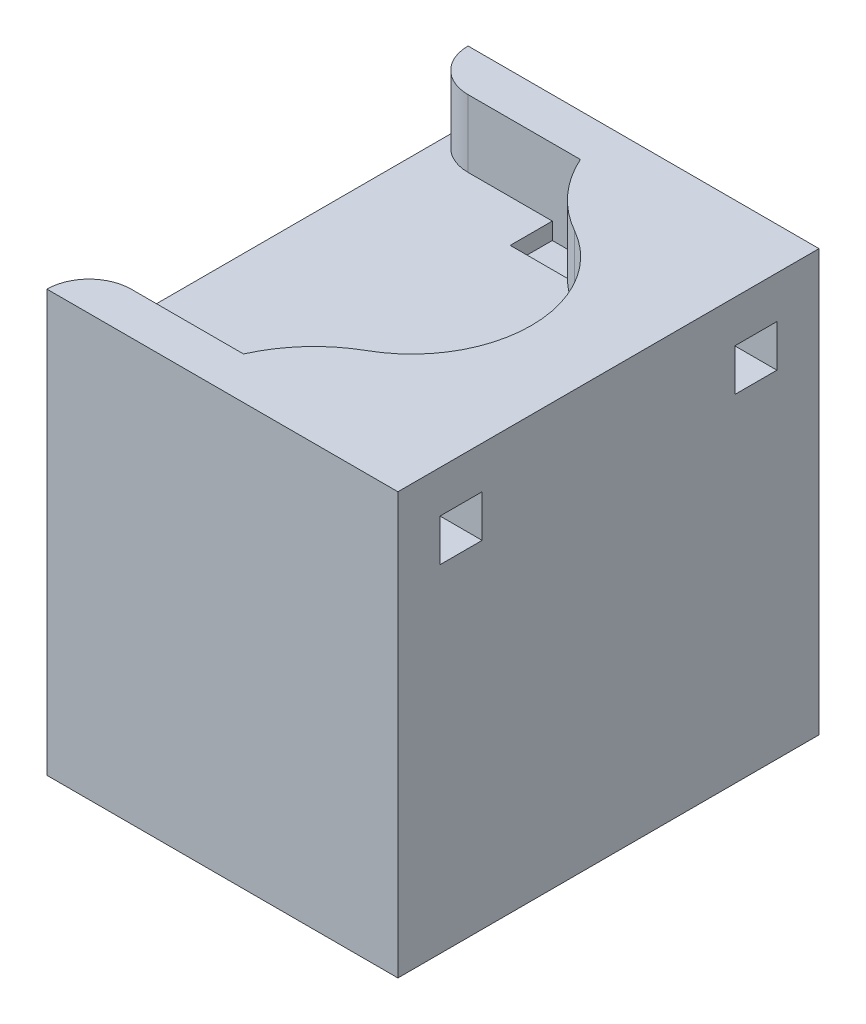
from build123d import *

# Parameters (mm, degrees)
SKETCH1_W           = 25
SKETCH1_H           = 30
BOSS_EXTRUDE1_DEPTH = 30
SKETCH3_W           = 3
SKETCH3_H           = 3
CUT_EXTRUDE1_DEPTH  = 16
CUT_EXTRUDE2_DEPTH  = 4.8
FILLET1_R           = 10
FILLET2_R           = 3


# Some blends are built 0.0001 mm under size
with BuildPart() as part:
    # Sketch1 → Boss-Extrude1 (new body)
    with BuildSketch(Plane(origin=(0, 0, 0), x_dir=(1, 0, 0), z_dir=(0, 1, 0))):
        Rectangle(SKETCH1_W, SKETCH1_H)
    extrude(amount=BOSS_EXTRUDE1_DEPTH)

    # Sketch3 → Cut-Extrude1 (cut)
    with BuildSketch(Plane(origin=(12.5, 0, 0), x_dir=(0, 0, -1), z_dir=(1, 0, 0))):
        with Locations((10.5, 25.5)):
            Rectangle(SKETCH3_W, SKETCH3_H)
        with Locations((-10.5, 25.5)):
            Rectangle(SKETCH3_W, SKETCH3_H)
    extrude(amount=-CUT_EXTRUDE1_DEPTH, mode=Mode.SUBTRACT)

    # Sketch5 → Cut-Extrude2 (cut)
    with BuildSketch(Plane(origin=(0, 30, 0), x_dir=(1, 0, 0), z_dir=(0, 1, 0))):
        with BuildLine():
            Line((-12.5, -12), (-1.5, -12))
            Line((-1.5, -12), (-1.5, -8.5))
            ThreePointArc((-1.5, -8.5), (7, 0), (-1.5, 8.5))
            Line((-1.5, 8.5), (-1.5, 12))
            Line((-1.5, 12), (-12.5, 12))
            Line((-12.5, 12), (-12.5, -12))
        make_face()
    extrude(amount=-CUT_EXTRUDE2_DEPTH, mode=Mode.SUBTRACT)

    # Fillet1
    # the kernel refuses this fillet: 10 mm, written as the material it takes off along each edge
    with BuildSketch(Plane(origin=(-1.5, 40.838231957, 8.5), x_dir=(0, 0, 1), z_dir=(0, -1, 0))) as fillet1_piece_1:
        with BuildLine():
            CenterArc((7.59375, -9.123662145), FILLET1_R, 114.165579325, 36.285209338)
            Line((-1.105574324, -4.191952877), (-1.279560811, -4.093318692))
            ThreePointArc((-1.279560811, -4.093318692), (-0.474426959, -2.116642947), (-0.2, 0))
            Line((-0.2, 0), (0, 0.2))
            ThreePointArc((0, 0.2), (1.75, 0.2), (3.418125, 0.182473243))
            Line((3.418125, 0.182473243), (3.5, 0))
        make_face()
    extrude(amount=15.638231957, mode=Mode.SUBTRACT)
    with BuildSketch(Plane(origin=(-1.5, 40.838231957, -8.5), x_dir=(0.9669365109541641, 0, 0.2550172225238677), z_dir=(0, -1, 0))) as fillet1_piece_2:
        with BuildLine():
            CenterArc((6.885465008, -9.66936511), FILLET1_R, 104.774605668, 36.285209338)
            Line((-0.892560279, -3.384277788), (-1.048120785, -3.258576042))
            ThreePointArc((-1.048120785, -3.258576042), (-0.639667442, -1.64113545), (-0.193387302, 0.051003445))
            Line((-0.193387302, 0.051003445), (0.051003445, 0.193387302))
            ThreePointArc((0.051003445, 0.193387302), (2.167646391, -0.081039657), (4.284289338, 0.193387302))
            Line((4.284289338, 0.193387302), (4.335292783, 0))
        make_face()
    extrude(amount=15.638231957, mode=Mode.SUBTRACT)

    # Fillet2
    fillet2_edges = [part.edges().sort_by_distance(p)[0] for p in [
        (-12.5, 27.6, 12),
        (-12.5, 27.6, -12),
    ]]
    fillet(fillet2_edges, radius=FILLET2_R - 0.0001)  # a hair under: the kernel refuses the full size


solid = part.part
